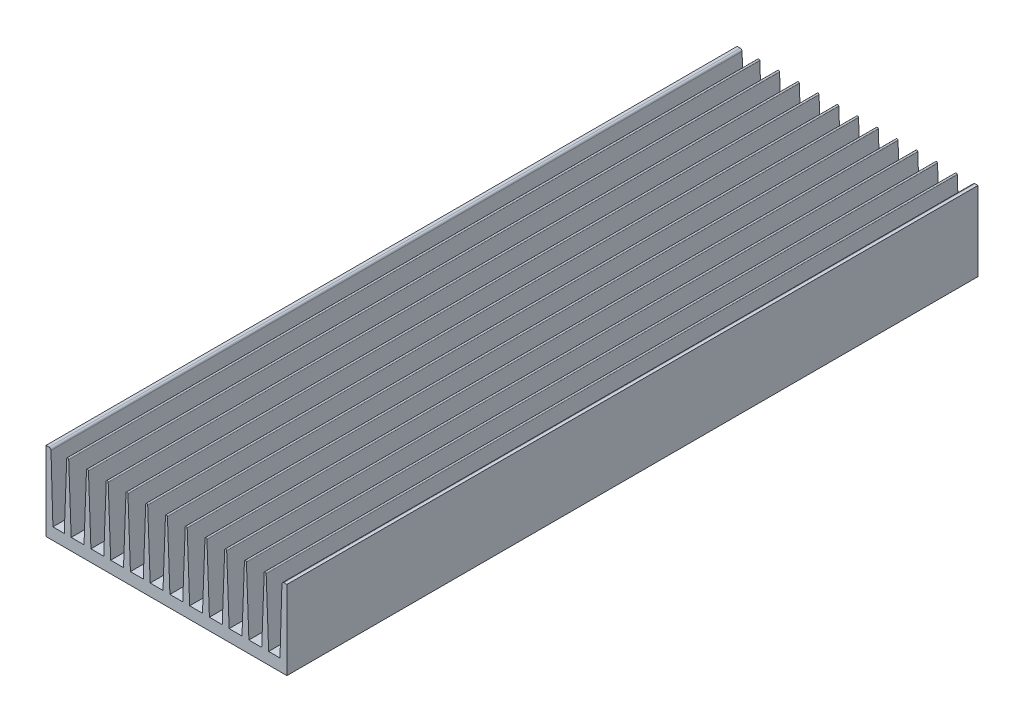
from build123d import *

# Parameters (mm, degrees)
EXTRUDE_1_DEPTH       = 350
EXTRUDE_3_DEPTH       = 350
PATTERN_CURVE_1_COUNT = 11
PATTERN_CURVE_1_PITCH = 10
SKETCH_3_R            = 2.25
CUT_EXTRUDE_1_DEPTH   = 6
SKETCH_4_R            = 1.6
SKETCH_4_R_2          = 2.25
SKETCH_4_R_3          = 2.1
SKETCH_4_R_4          = 1.1
CUT_EXTRUDE_2_DEPTH   = 6


with BuildPart() as part:
    # Эскиз1 → Вытянуть1 (new body)
    with BuildSketch(Plane.XY):
        with BuildLine():
            Line((0, 40), (1.528979332, 40))
            ThreePointArc((1.528979332, 40), (2.225614441, 39.717425624), (2.528547087, 39.029399052))
            Line((2.528547087, 39.029399052), (3.5, 6))
            Line((3.5, 6), (118.5, 6))
            Line((118.5, 6), (119.471452913, 39.029399052))
            ThreePointArc((119.471452913, 39.029399052), (119.774385559, 39.717425624), (120.471020668, 40))
            Line((120.471020668, 40), (122, 40))
            Line((122, 40), (122, 0))
            Line((122, 0), (0, 0))
            Line((0, 0), (0, 40))
        make_face()
    extrude(amount=EXTRUDE_1_DEPTH)

    # Эскиз2 → Вытянуть3 (add)
    with BuildSketch(Plane.XY.offset(350)):
        with BuildLine():
            Line((10.5, 39.5), (9.25, 6))
            Line((9.25, 6), (12.75, 6))
            Line((12.75, 6), (11.5, 39.5))
            ThreePointArc((11.5, 39.5), (11, 40), (10.5, 39.5))
        make_face()
    extrude_3 = extrude(amount=-EXTRUDE_3_DEPTH)

    # Кривая1: Вытянуть3 ×11
    with Locations(*[(i * PATTERN_CURVE_1_PITCH, 0, 0) for i in range(1, PATTERN_CURVE_1_COUNT)]):
        add(extrude_3)

    # Эскиз3 → Вырез-Вытянуть1 (cut)
    with BuildSketch(Plane.XZ):
        with Locations((26, 342)):
            Circle(SKETCH_3_R)
        with Locations((96, 342)):
            Circle(SKETCH_3_R)
        with Locations((96, 8)):
            Circle(SKETCH_3_R)
        with Locations((26, 8)):
            Circle(SKETCH_3_R)
    extrude(amount=-CUT_EXTRUDE_1_DEPTH, mode=Mode.SUBTRACT)

    # Эскиз4 → Вырез-Вытянуть2 (cut)
    with BuildSketch(Plane.XZ):
        with Locations((55, 25)):
            Circle(SKETCH_4_R)
        with Locations((90, 25)):
            Circle(SKETCH_4_R)
        with Locations((55, 85)):
            Circle(SKETCH_4_R)
        with Locations((90, 85)):
            Circle(SKETCH_4_R)
        with Locations((112, 25)):
            Circle(SKETCH_4_R_2)
        with Locations((55, 115)):
            Circle(SKETCH_4_R_3)
        with Locations((84.5, 115)):
            Circle(SKETCH_4_R)
        with Locations((112, 107)):
            Circle(SKETCH_4_R_2)
        with Locations((96, 320)):
            Circle(SKETCH_4_R_2)
        with Locations((96, 295)):
            Circle(SKETCH_4_R_2)
        with Locations((55, 140)):
            Circle(SKETCH_4_R_4)
        with Locations((55, 166)):
            Circle(SKETCH_4_R_4)
        with Locations((55, 195)):
            Circle(SKETCH_4_R)
        with Locations((84.5, 255)):
            Circle(SKETCH_4_R)
    extrude(amount=-CUT_EXTRUDE_2_DEPTH, mode=Mode.SUBTRACT)


solid = part.part
